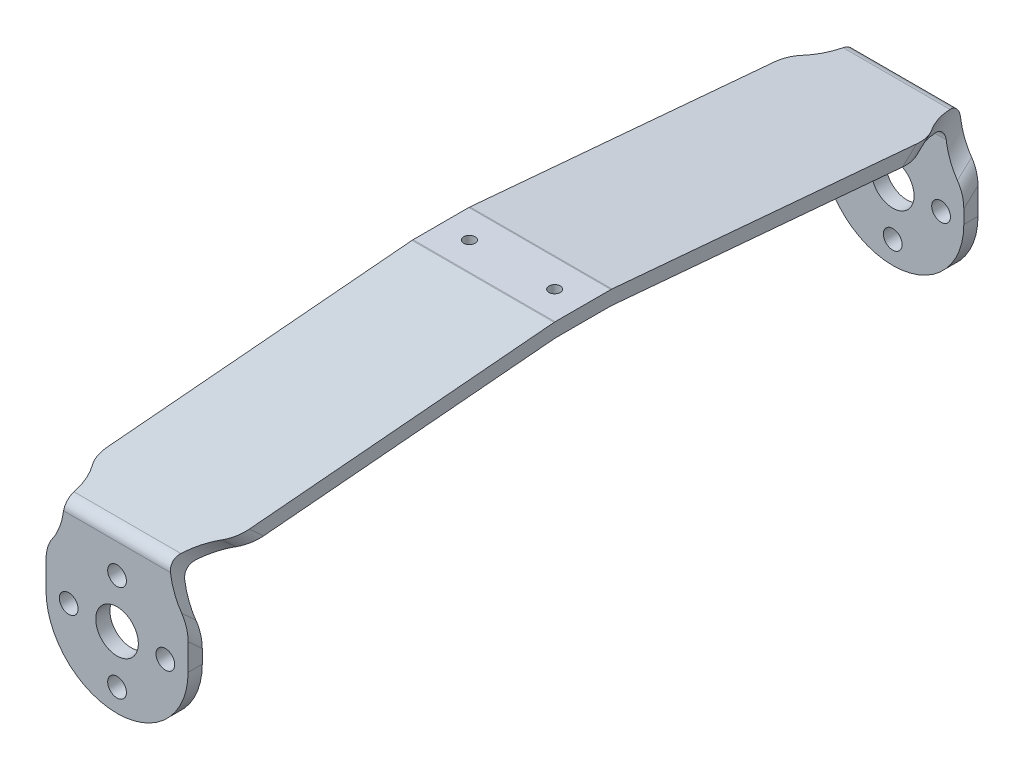
from build123d import *

# Parameters (mm, degrees)
RESSALTO_EXTRUS_O2_DEPTH = 25
ESBO_O9_R                = 3.75
ESBO_O9_R_2              = 1.65
CORTE_EXTRUS_O1_DEPTH    = 20
FILETE1_R                = 12.5
FILETE2_START            = -1
FILETE2_DEPTH            = 27
FILETE2_2_DEPTH          = 25
ESBO_O10_R               = 1
CORTE_EXTRUS_O2_DEPTH    = 82.160967921
ESBO_O11_R               = 7.5
CORTE_EXTRUS_O3_DEPTH    = 10
FILETE3_R                = 4


with BuildPart() as part:
    # Esboço2 → Ressalto-extrusão2 (new body)
    with BuildSketch(Plane(origin=(0, 0, 0), x_dir=(0, 0, -1), z_dir=(1, 0, 0))):
        Polygon((-5, 0), (0, 0), (5, 0), (69.5, -5.643018797), (69.5, -33.643018797), (67, -33.643018797), (67, -7.933846732), (4.890847643, -2.5), (0, -2.5), (-4.890847643, -2.5), (-67, -7.933846732), (-67, -33.643018797), (-69.5, -33.643018797), (-69.5, -5.643018797), align=None)
    extrude(amount=RESSALTO_EXTRUS_O2_DEPTH)

    # Esboço9 → Corte-extrusão1 (cut)
    with BuildSketch(Plane.XY.offset(69.5)):
        with Locations((12.5, -21.143018797)):
            Circle(ESBO_O9_R)
        with Locations((12.5, -12.643018797)):
            Circle(ESBO_O9_R_2)
        with Locations((21, -21.143018797)):
            Circle(ESBO_O9_R_2)
        with Locations((12.5, -29.643018797)):
            Circle(ESBO_O9_R_2)
        with Locations((4, -21.143018797)):
            Circle(ESBO_O9_R_2)
    corte_extrus_o1 = extrude(amount=-CORTE_EXTRUS_O1_DEPTH, mode=Mode.SUBTRACT)

    # Espelhar1: Corte-extrusão1 across plane
    add(corte_extrus_o1.mirror(Plane.XY), mode=Mode.SUBTRACT)

    # Filete1
    filete1_edges = [part.edges().sort_by_distance(p)[0] for p in [
        (0, -33.643018797, 68.25),
        (25, -33.643018797, 68.25),
        (25, -33.643018797, -68.25),
        (0, -33.643018797, -68.25),
    ]]
    fillet(filete1_edges, radius=FILETE1_R - 0.0001)  # a hair under: the kernel refuses the full size

    # Filete2: read off the stored shape, not the designer's step
    # Filete2 outline → Filete2 (cut)
    with BuildSketch(Plane.YZ.offset(FILETE2_START)):
        with BuildLine():
            Line((0, -5), (0, -4.912678114))
            ThreePointArc((0, -4.912678114), (-0.001903557, -4.999916889), (-0.007610604, -5.0869896))
            Line((-0.007610604, -5.0869896), (0, -5))
        make_face()
        with BuildLine():
            ThreePointArc((-7.475681145, 69.5), (-6.12450073, 68.974554674), (-5.483291749, 67.674311485))
            Line((-5.483291749, 67.674311485), (-5.643018797, 69.5))
            Line((-5.643018797, 69.5), (-7.475681145, 69.5))
        make_face()
        with BuildLine():
            ThreePointArc((-0.007610604, 5.0869896), (-0.001903557, 4.999916889), (0, 4.912678114))
            Line((0, 4.912678114), (0, 5))
            Line((0, 5), (-0.007610604, 5.0869896))
        make_face()
        with BuildLine():
            Line((-5.643018797, -69.5), (-5.483291749, -67.674311485))
            ThreePointArc((-5.483291749, -67.674311485), (-6.12450073, -68.974554674), (-7.475681145, -69.5))
            Line((-7.475681145, -69.5), (-5.643018797, -69.5))
        make_face()
    extrude(amount=FILETE2_DEPTH, mode=Mode.SUBTRACT)

    # Filete2 2 outline → Filete2 2 (add)
    with BuildSketch(Plane.YZ):
        with BuildLine():
            ThreePointArc((-9.766509081, 67), (-8.415328665, 66.474554674), (-7.774119684, 65.174311485))
            Line((-7.774119684, 65.174311485), (-7.933846732, 67))
            Line((-7.933846732, 67), (-9.766509081, 67))
        make_face()
        with BuildLine():
            ThreePointArc((-2.507610604, 4.977837242), (-2.501903557, 4.890764531), (-2.5, 4.803525757))
            Line((-2.5, 4.803525757), (-2.5, 4.890847643))
            Line((-2.5, 4.890847643), (-2.507610604, 4.977837242))
        make_face()
        with BuildLine():
            Line((-7.933846732, -67), (-7.774119684, -65.174311485))
            ThreePointArc((-7.774119684, -65.174311485), (-8.415328665, -66.474554674), (-9.766509081, -67))
            Line((-9.766509081, -67), (-7.933846732, -67))
        make_face()
        with BuildLine():
            ThreePointArc((-2.5, -4.803525757), (-2.501903557, -4.890764531), (-2.507610604, -4.977837242))
            Line((-2.507610604, -4.977837242), (-2.5, -4.890847643))
            Line((-2.5, -4.890847643), (-2.5, -4.803525757))
        make_face()
    extrude(amount=FILETE2_2_DEPTH)

    # Esboço10 → Corte-extrusão2 (cut, through all)
    with BuildSketch(Plane(origin=(0, 0, 0), x_dir=(1, 0, 0), z_dir=(0, 1, 0))):
        with Locations(Location((5, 0, 0), (0, 0, 270))):
            Circle(ESBO_O10_R)
        with Locations(Location((20, 0, 0), (0, 0, 270))):
            Circle(ESBO_O10_R)
    extrude(amount=-CORTE_EXTRUS_O2_DEPTH, mode=Mode.SUBTRACT)

    # Esboço11 → Corte-extrusão3 (cut, symmetric)
    with BuildSketch(Plane(origin=(0, 31.205699457, -34.0550451), x_dir=(1, 0, 0), z_dir=(0, -0.6755902076156625, 0.7372773368101221))):
        with Locations((-4.282064203, -51.1139893)):
            Circle(ESBO_O11_R)
        with Locations((29.282064203, -51.1139893)):
            Circle(ESBO_O11_R)
    corte_extrus_o3 = extrude(amount=CORTE_EXTRUS_O3_DEPTH, both=True, mode=Mode.SUBTRACT)

    # Espelhar2: Corte-extrusão3 across plane
    add(corte_extrus_o3.mirror(Plane.XY), mode=Mode.SUBTRACT)

    # Filete3
    filete3_edges = [part.edges().sort_by_distance(p)[0] for p in [
        (25, -15.140009882, -68.25),
        (25, -6.060544858, -59.930203155),
        (0, -6.060544858, -59.930203155),
        (0, -15.140009882, -68.25),
        (0, -15.140009882, 68.25),
        (0, -6.060544858, 59.930203155),
        (25, -15.140009882, 68.25),
        (25, -6.060544858, 59.930203155),
    ]]
    fillet(filete3_edges, radius=FILETE3_R)


solid = part.part
